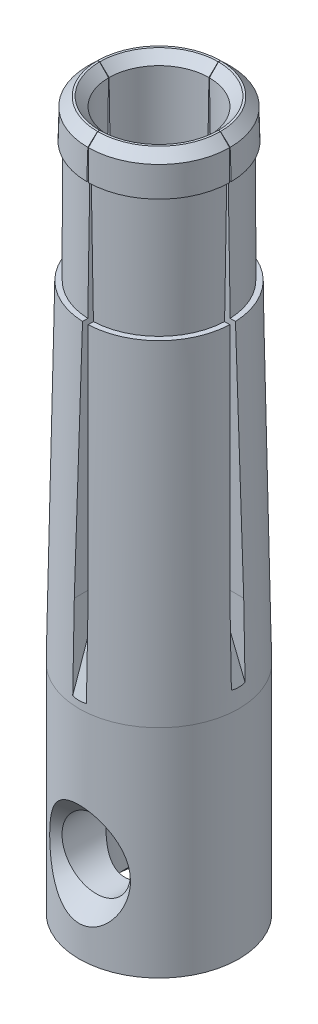
from build123d import *
from OCP.BRepFilletAPI import BRepFilletAPI_MakeChamfer

# Parameters (mm, degrees)
SKETCH1_W               = 3.5
SKETCH1_H               = 9.5
SKETCH2_R               = 2.2
CUT_EXTRUDE1_DEPTH      = 19.4
SKETCH3_R               = 2
CUT_EXTRUDE2_DEPTH      = 8.8
CUT_EXTRUDE3_DEPTH      = 32.972644557
CUT_EXTRUDE4_DEPTH      = 32.972644557
CUT_EXTRUDE5_DEPTH      = 0.3
CUT_EXTRUDE5_DEPTH_BACK = 0.3
CUT_EXTRUDE6_DEPTH      = 0.3
CUT_EXTRUDE6_DEPTH_BACK = 0.3
CUT_EXTRUDE7_START      = 5.3
SKETCH15_R              = 3.5
SKETCH15_R_2            = 3
CUT_EXTRUDE7_DEPTH      = 5.3
CHAMFER1_SIZE           = 0.4
CHAMFER1_SIZE2          = 0.407653471


# Read off the part's stored shape, not the designer's step: CSK for M3 Oval Head Machine Screw1
with BuildPart() as part:
    # Sketch1 → Revolve1 (revolve)
    with BuildSketch(Plane.XY, mode=Mode.PRIVATE) as revolve1_sk:
        Polygon((0, 9.5), (3.5, 9.5), (3.1, 31), (0, 31), align=None)
        with Locations((1.75, 4.75)):
            Rectangle(SKETCH1_W, SKETCH1_H)
    revolve(revolve1_sk.sketch.rotate(Axis((0, 0, 0), (0, 1, 0)), 90), axis=Axis((0, 0, 0), (0, 1, 0)))

    # Sketch2 → Cut-Extrude1 (cut)
    with BuildSketch(Plane(origin=(0, 31, 0), x_dir=(1, 0, 0), z_dir=(0, 1, 0))):
        with Locations(Location((0, 0, 0), (0, 0, 270))):
            Circle(SKETCH2_R)
    extrude(amount=-CUT_EXTRUDE1_DEPTH, mode=Mode.SUBTRACT)

    # Sketch3 → Cut-Extrude2 (cut)
    with BuildSketch(Plane.XZ):
        with Locations(Location((0, -0.502631205, 0), (0, 0, 270))):
            Circle(SKETCH3_R)
    extrude(amount=-CUT_EXTRUDE2_DEPTH, mode=Mode.SUBTRACT)

    # Sketch5 → Cut-Extrude3 (cut, through all)
    with BuildSketch(Plane(origin=(3.5, 0, 0), x_dir=(0, 0, -1), z_dir=(1, 0, 0))):
        Polygon((0.3, 13.5), (-0.3, 13.5), (-0.005, 31), (0.005, 31), align=None)
    extrude(amount=-CUT_EXTRUDE3_DEPTH, mode=Mode.SUBTRACT)

    # Sketch9 → Cut-Extrude4 (cut, through all)
    with BuildSketch(Plane.XY.offset(3.5)):
        Polygon((0.3, 13.5), (-0.3, 13.5), (-0.005, 31), (0.005, 31), align=None)
    extrude(amount=-CUT_EXTRUDE4_DEPTH, mode=Mode.SUBTRACT)

    # Sketch11 → Cut-Extrude5 (cut, two sides: drawn at the far end of the back side and taken through both)
    with BuildSketch(Plane.XY.offset(-CUT_EXTRUDE5_DEPTH_BACK)):
        Polygon((-3.485105978, 10.300553669), (-3.425581395, 13.5), (-2.2, 13.5), align=None)
        Polygon((2.2, 13.5), (3.485105978, 10.300553669), (3.425581395, 13.5), align=None)
    extrude(amount=CUT_EXTRUDE5_DEPTH + CUT_EXTRUDE5_DEPTH_BACK, mode=Mode.SUBTRACT)

    # Sketch14 → Cut-Extrude6 (cut, two sides: drawn at the far end of the back side and taken through both)
    with BuildSketch(Plane(origin=(0, 0, 0), x_dir=(0, 0, -1), z_dir=(1, 0, 0)).offset(-CUT_EXTRUDE6_DEPTH_BACK)):
        Polygon((2.2, 13.5), (3.425581395, 13.5), (3.494418605, 9.8), align=None)
        Polygon((-3.425581395, 13.5), (-3.494418605, 9.8), (-2.2, 13.5), align=None)
    extrude(amount=CUT_EXTRUDE6_DEPTH + CUT_EXTRUDE6_DEPTH_BACK, mode=Mode.SUBTRACT)

    # Sketch15 → Cut-Extrude7 (cut)
    with BuildSketch(Plane(origin=(0, 24, 0), x_dir=(1, 0, 0), z_dir=(0, 1, 0)).offset(CUT_EXTRUDE7_START)):
        with Locations(Location((0, 0, 0), (0, 0, 90))):
            Circle(SKETCH15_R)
        Circle(SKETCH15_R_2, mode=Mode.SUBTRACT)
    extrude(amount=-CUT_EXTRUDE7_DEPTH, mode=Mode.SUBTRACT)

    # CSK for M3 Oval Head Machine Screw1 outl → CSK for M3 Oval Head Machine Screw1 (revolve, cut)
    with BuildSketch(Plane.XZ.offset(-3.6)):
        Polygon((0, 0.819848747), (1.5, 0.819848747), (1.5, 2.75), (2.250138013, 3.500138013), (0, 3.500138013), align=None)
    revolve(axis=Axis((0, 3.6, 0), (0, 0, 1)), mode=Mode.SUBTRACT)

    # Chamfer1: one chamfer whose edges measure the first distance from different faces: ONE call of the kernel's chamfer builder (chamfer() names one face for all edges)
    chamfer1_edges_1 = [part.edges().sort_by_distance(p)[0] for p in [
        (-2.192031022, 31, -2.192031022),
    ]]
    chamfer1_side_1 = [part.faces().sort_by_distance(p)[0] for p in [
        (-2.203213175, 30.15, -2.203213175),
    ]]
    chamfer1_edges_2 = [part.edges().sort_by_distance(p)[0] for p in [
        (2.192031022, 31, -2.192031022),
    ]]
    chamfer1_side_2 = [part.faces().sort_by_distance(p)[0] for p in [
        (2.203213175, 30.15, -2.203213175),
    ]]
    chamfer1_edges_3 = [part.edges().sort_by_distance(p)[0] for p in [
        (2.192031022, 31, 2.192031022),
    ]]
    chamfer1_side_3 = [part.faces().sort_by_distance(p)[0] for p in [
        (2.203213175, 30.15, 2.203213175),
    ]]
    chamfer1_edges_4 = [part.edges().sort_by_distance(p)[0] for p in [
        (-2.192031022, 31, 2.192031022),
    ]]
    chamfer1_side_4 = [part.faces().sort_by_distance(p)[0] for p in [
        (-2.203213175, 30.15, 2.203213175),
    ]]
    chamfer1_edges_5 = [part.edges().sort_by_distance(p)[0] for p in [
        (-1.555634919, 31, -1.555634919),
        (1.555634919, 31, -1.555634919),
        (1.555634919, 31, 1.555634919),
        (-1.555634919, 31, 1.555634919),
        (0, 0, 1.497368795),
    ]]
    chamfer1 = BRepFilletAPI_MakeChamfer(part.part.solid().wrapped)
    for e in chamfer1_edges_1:
        chamfer1.Add(CHAMFER1_SIZE, CHAMFER1_SIZE2, e.wrapped, chamfer1_side_1[0].wrapped)  # the first distance lies on this face
    for e in chamfer1_edges_2:
        chamfer1.Add(CHAMFER1_SIZE, CHAMFER1_SIZE2, e.wrapped, chamfer1_side_2[0].wrapped)  # the first distance lies on this face
    for e in chamfer1_edges_3:
        chamfer1.Add(CHAMFER1_SIZE, CHAMFER1_SIZE2, e.wrapped, chamfer1_side_3[0].wrapped)  # the first distance lies on this face
    for e in chamfer1_edges_4:
        chamfer1.Add(CHAMFER1_SIZE, CHAMFER1_SIZE2, e.wrapped, chamfer1_side_4[0].wrapped)  # the first distance lies on this face
    for e in chamfer1_edges_5:
        chamfer1.Add(CHAMFER1_SIZE, e.wrapped)
    add(Compound.cast(chamfer1.Shape()), mode=Mode.REPLACE)


solid = part.part
